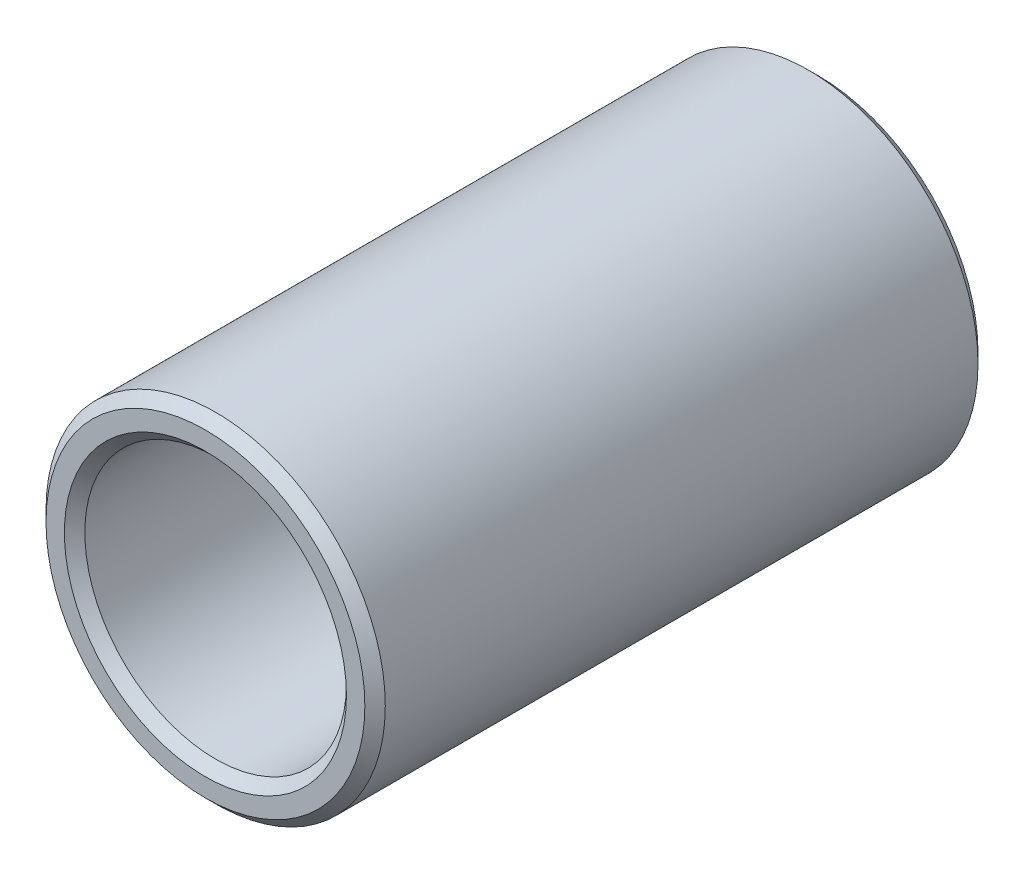
from build123d import *

# Parameters (mm, degrees)
SKETCH1_R           = 4.15
SKETCH1_R_2         = 3.2
BOSS_EXTRUDE1_DEPTH = 15
CHAMFER1_SIZE       = 0.25


with BuildPart() as part:
    # Sketch1 → Boss-Extrude1 (new body)
    with BuildSketch(Plane.XY):
        Circle(SKETCH1_R)
        Circle(SKETCH1_R_2, mode=Mode.SUBTRACT)
    extrude(amount=BOSS_EXTRUDE1_DEPTH)

    # Chamfer1
    chamfer1_edges = [part.edges().sort_by_distance(p)[0] for p in [
        (-3.2, 0, 15),
        (-4.15, 0, 15),
        (-3.2, 0, 0),
        (-4.15, 0, 0),
    ]]
    chamfer(chamfer1_edges, length=CHAMFER1_SIZE)


solid = part.part
